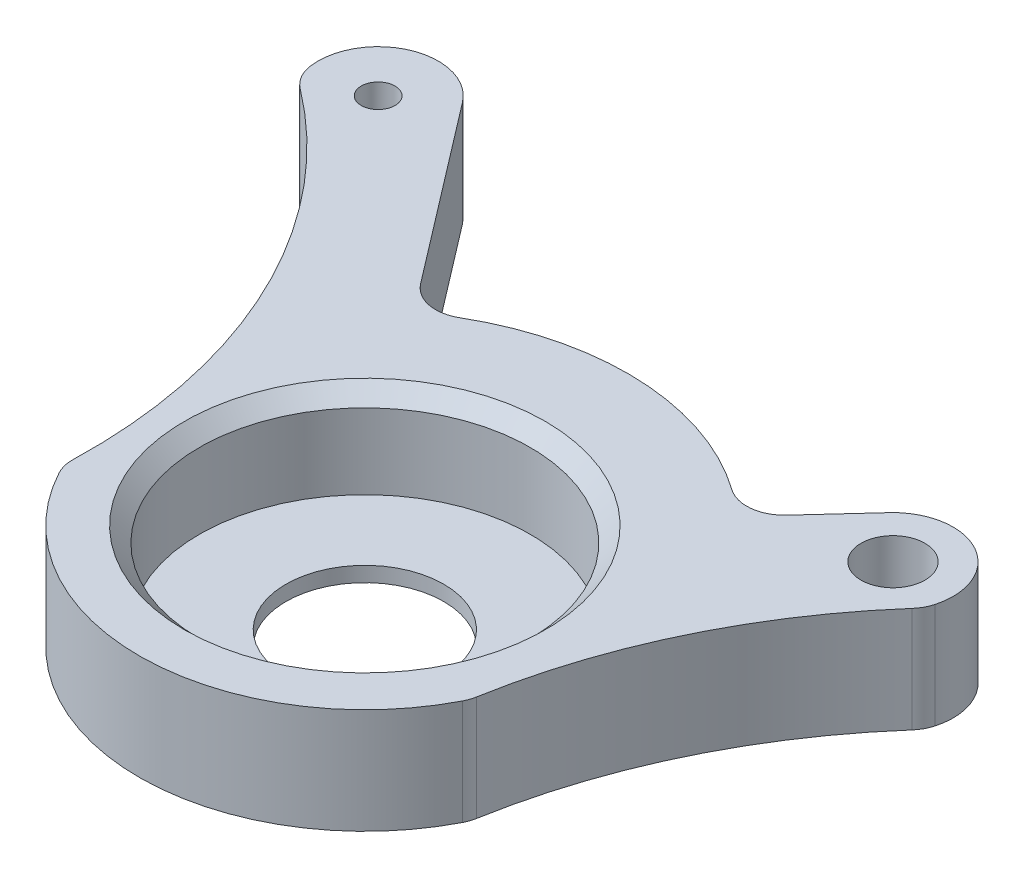
from build123d import *

# Parameters (mm, degrees)
SKETCH1_R           = 11
SKETCH1_R_2         = 1.125
SKETCH1_R_3         = 2.125
BOSS_EXTRUDE1_DEPTH = 6
CHAMFER1_SIZE       = 1
CUT_EXTRUDE2_DEPTH  = 42.096430737
CUT_EXTRUDE3_DEPTH  = 42.096430737
FILLET2_R           = 2.5
BOSS_EXTRUDE2_START = 1
SKETCH4_R           = 2.125
SKETCH4_R_2         = 1.125
SKETCH4_R_3         = 5.25
BOSS_EXTRUDE2_DEPTH = 1


with BuildPart() as part:
    # Sketch1 → Boss-Extrude1 (new body)
    with BuildSketch(Plane(origin=(0, 0, 0), x_dir=(1, 0, 0), z_dir=(0, 1, 0))):
        with BuildLine():
            Line((-13.520829845, -6.495164379), (-27.908266492, 23.454821709))
            ThreePointArc((-27.908266492, 23.454821709), (-27.437325222, 27.671659119), (-23.439257561, 29.092559677))
            Line((-23.439257561, 29.092559677), (20.499801437, 19.378698733))
            ThreePointArc((20.499801437, 19.378698733), (23.233433807, 17.222566673), (23.241901756, 13.740960766))
            Line((23.241901756, 13.740960766), (13.520829845, -6.495164379))
            ThreePointArc((13.520829845, -6.495164379), (0, -15), (-13.520829845, -6.495164379))
        make_face()
        Circle(SKETCH1_R, mode=Mode.SUBTRACT)
        with Locations((-24.302711867, 25.186865544)):
            Circle(SKETCH1_R_2, mode=Mode.SUBTRACT)
        with Locations((19.636347131, 15.4730046)):
            Circle(SKETCH1_R_3, mode=Mode.SUBTRACT)
    extrude(amount=BOSS_EXTRUDE1_DEPTH)

    # Chamfer1
    chamfer1_edges = [part.edges().sort_by_distance(p)[0] for p in [
        (-11, 6, 0),
    ]]
    chamfer(chamfer1_edges, length=CHAMFER1_SIZE)

    # Sketch3 → Cut-Extrude2 (cut, through all)
    with BuildSketch(Plane(origin=(0, 6, 0), x_dir=(1, 0, 0), z_dir=(0, 1, 0))):
        with BuildLine():
            Line((11.835384131, 12.890837151), (16.689870068, 18.178235259))
            ThreePointArc((16.689870068, 18.178235259), (18.434255583, 19.288103015), (20.499801437, 19.378698733))
            Line((20.499801437, 19.378698733), (-23.439257561, 29.092559677))
            ThreePointArc((-23.439257561, 29.092559677), (-22.151978942, 28.559453258), (-21.125649919, 27.617148939))
            Line((-21.125649919, 27.617148939), (-10.632489853, 13.899646022))
            ThreePointArc((-10.632489853, 13.899646022), (0.784960187, 17.482386493), (11.835384131, 12.890837151))
        make_face()
    extrude(amount=-CUT_EXTRUDE2_DEPTH, mode=Mode.SUBTRACT)

    # Sketch5 → Cut-Extrude3 (cut, through all)
    with BuildSketch(Plane(origin=(0, 6, 0), x_dir=(1, 0, 0), z_dir=(0, 1, 0))):
        with BuildLine():
            Line((-27.908266492, 23.454821709), (-13.520829845, -6.495164379))
            ThreePointArc((-13.520829845, -6.495164379), (-16.933983168, 10.295944348), (-27.908266492, 23.454821709))
        make_face()
        with BuildLine():
            Line((13.520829845, -6.495164379), (23.241901756, 13.740960766))
            ThreePointArc((23.241901756, 13.740960766), (16.9325707, 4.318873398), (13.520829845, -6.495164379))
        make_face()
    extrude(amount=-CUT_EXTRUDE3_DEPTH, mode=Mode.SUBTRACT)

    # Fillet2
    fillet2_edges = [part.edges().sort_by_distance(p)[0] for p in [
        (11.835384131, 3, -12.890837151),
        (-10.632489853, 3, -13.899646022),
        (-13.520829845, 3, 6.495164379),
        (-27.908266492, 3, -23.454821709),
        (13.520829845, 3, 6.495164379),
        (23.241901756, 3, -13.740960766),
    ]]
    fillet(fillet2_edges, radius=FILLET2_R)

    # Sketch4 → Boss-Extrude2 (add)
    with BuildSketch(Plane.XZ.offset(BOSS_EXTRUDE2_START)):
        with BuildLine():
            Line((-21.125649919, -27.617148939), (-12.056110272, -15.760717151))
            ThreePointArc((-12.056110272, -15.760717151), (-10.555018486, -14.827055836), (-8.811640735, -15.119688739))
            ThreePointArc((-8.811640735, -15.119688739), (0.784960187, -17.482386493), (10.131201512, -14.269154002))
            ThreePointArc((10.131201512, -14.269154002), (11.841338456, -13.821458085), (13.420064178, -14.616835412))
            Line((13.420064178, -14.616835412), (16.689870068, -18.178235259))
            ThreePointArc((16.689870068, -18.178235259), (21.574047558, -18.972335544), (23.492842792, -14.411194255))
            ThreePointArc((23.492842792, -14.411194255), (23.282265374, -13.886895798), (22.95933206, -13.423273328))
            ThreePointArc((22.95933206, -13.423273328), (16.917947827, -4.288400331), (13.580568966, 6.142617379))
            ThreePointArc((13.580568966, 6.142617379), (13.487889496, 6.508737857), (13.341116661, 6.856719787))
            ThreePointArc((13.341116661, 6.856719787), (0.15369718, 14.999212552), (-13.197808195, 7.128664591))
            ThreePointArc((-13.197808195, 7.128664591), (-13.430500904, 6.518293714), (-13.497134338, 5.868479518))
            ThreePointArc((-13.497134338, 5.868479518), (-16.906608758, -10.238827334), (-27.303263134, -23.005166967))
            ThreePointArc((-27.303263134, -23.005166967), (-27.954513323, -23.743757687), (-28.270025149, -24.676546704))
            ThreePointArc((-28.270025149, -24.676546704), (-25.825180148, -28.885796515), (-21.125649919, -27.617148939))
        make_face()
        with Locations((19.636347131, -15.4730046)):
            Circle(SKETCH4_R, mode=Mode.SUBTRACT)
        with Locations((-24.302711867, -25.186865544)):
            Circle(SKETCH4_R_2, mode=Mode.SUBTRACT)
        Circle(SKETCH4_R_3, mode=Mode.SUBTRACT)
    extrude(amount=-BOSS_EXTRUDE2_DEPTH)


solid = part.part
